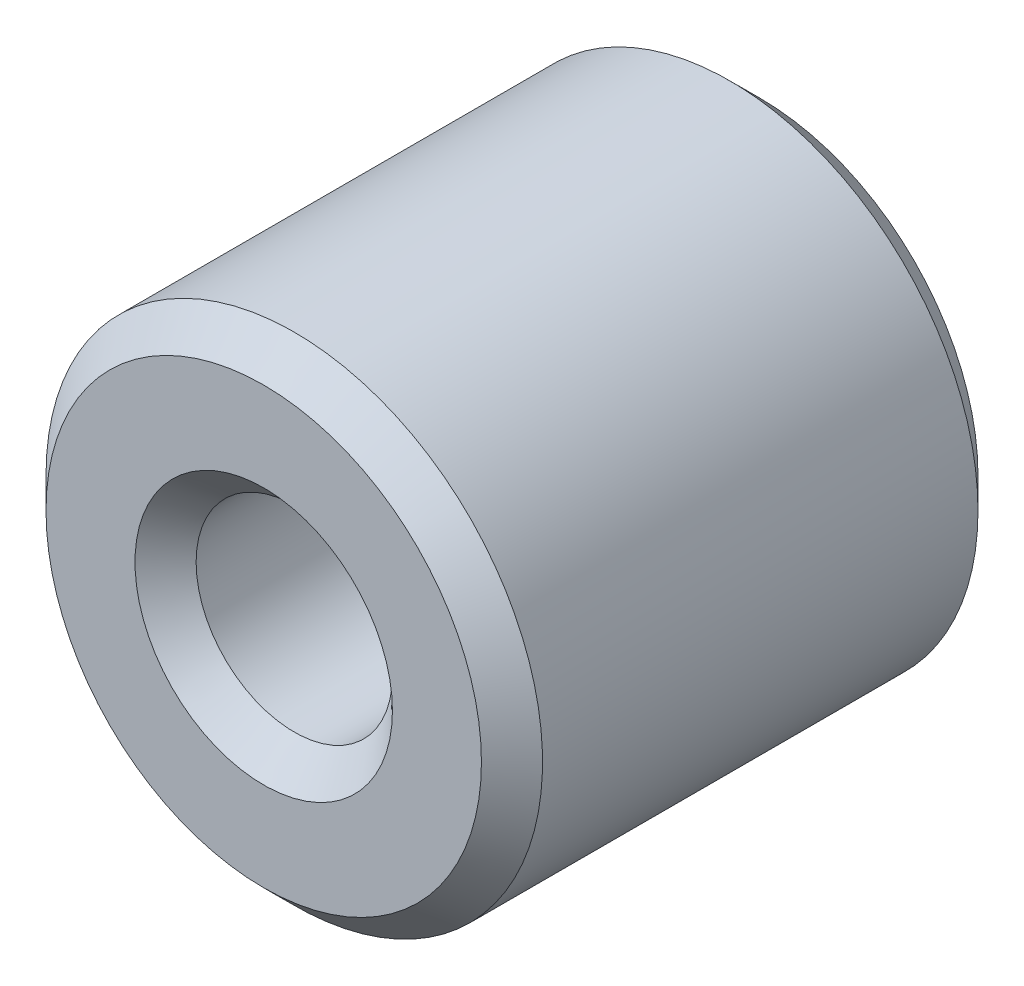
from build123d import *

# Parameters (mm, degrees)
SKETCH1_R           = 6.5
SKETCH1_R_2         = 2.57
BOSS_EXTRUDE1_DEPTH = 13
CHAMFER1_SIZE       = 0.8


with BuildPart() as part:
    # Sketch1 → Boss-Extrude1 (new body)
    with BuildSketch(Plane.XY):
        Circle(SKETCH1_R)
        Circle(SKETCH1_R_2, mode=Mode.SUBTRACT)
    extrude(amount=BOSS_EXTRUDE1_DEPTH)

    # Chamfer1
    chamfer1_edges = [part.edges().sort_by_distance(p)[0] for p in [
        (-2.57, 0, 0),
        (-6.5, 0, 0),
        (-2.57, 0, 13),
        (-6.5, 0, 13),
    ]]
    chamfer(chamfer1_edges, length=CHAMFER1_SIZE)


solid = part.part
